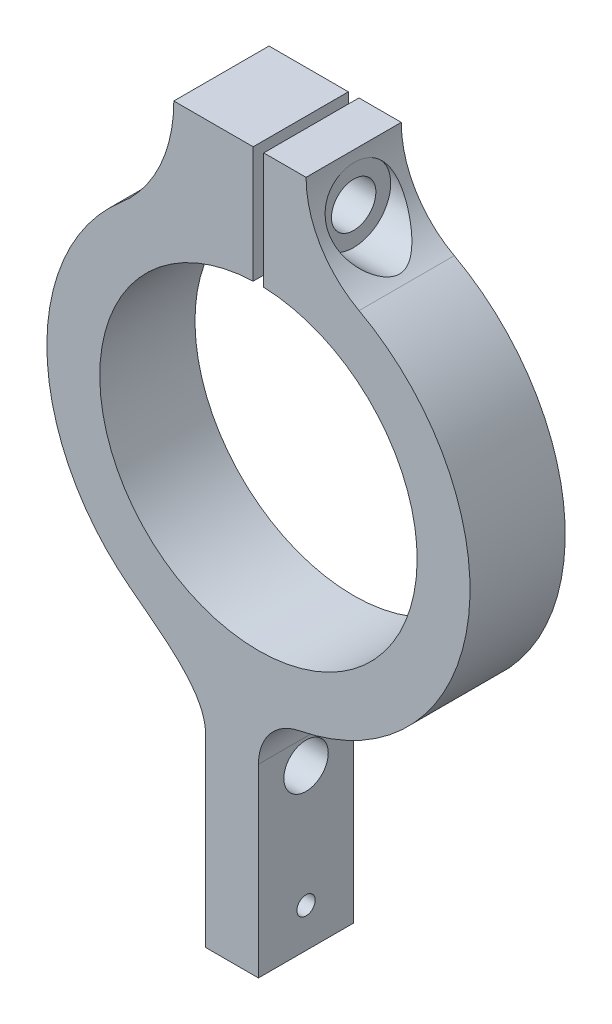
from build123d import *

# Parameters (mm, degrees)
MAIN_BODY_DEPTH       = 18
SKETCH14_W            = 4.2
SKETCH14_H            = 39
M8_CLEARANCE_HOLE2_D  = 8.4
M8_CLEARANCE_HOLE3_D  = 8.4
SKETCH27_R            = 7
CUT_EXTRUDE2_DEPTH    = 99.559772913
F_8_32_TAPPED_HOLE1_D = 3.4544


with BuildPart() as part:
    # Sketch1 → main body (new body)
    with BuildSketch(Plane.XY):
        with BuildLine():
            Line((0, -48.600411521), (0, -83.600411521))
            Line((0, -83.600411521), (-10, -83.600411521))
            Line((-10, -83.600411521), (-10, -48.600411521))
            add(Edge.make_bspline(
                [(-26.535230031, -29.931280748), (-20.948212629, -34.88438627), (-10, -40.904022772), (-10, -48.600411521)],
                knots=[0, 0, 0, 0, 1, 1, 1, 1], degree=3))
            ThreePointArc((-26.535230031, -29.931280748), (-39.998128482, 0.386934068), (-25.951219512, 30.43902439))
            ThreePointArc((-25.951219512, 30.43902439), (-18.607817439, 40.126684972), (-16, 52))
            Line((-16, 52), (-1, 52))
            Line((-1, 52), (-1, 29.983328701))
            ThreePointArc((-1, 29.983328701), (0, -30), (1, 29.983328701))
            Line((1, 29.983328701), (1, 52))
            Line((1, 52), (9, 52))
            ThreePointArc((9, 52), (11.695932832, 42.212959957), (19.02319236, 35.186903138))
            ThreePointArc((19.02319236, 35.186903138), (39.54457484, -6.018853774), (7.693084301, -39.253234949))
            ThreePointArc((7.693084301, -39.253234949), (2.170592409, -42.547452411), (0, -48.600411521))
        make_face()
    extrude(amount=MAIN_BODY_DEPTH)

    # Sketch14 → M8 Clearance Hole1 (revolve, cut)
    with BuildSketch(Plane(origin=(1, 43, 9), x_dir=(0, 0, 1), z_dir=(0, 1, 0))):
        with Locations((2.1, 19.5)):
            Rectangle(SKETCH14_W, SKETCH14_H)
    revolve(axis=Axis((-5.35, 43, 9), (1, 0, 0)), mode=Mode.SUBTRACT)

    # M8 Clearance Hole2 (through all)
    with Locations(Plane(origin=(1, 0, 0), x_dir=(0, 0, 1), z_dir=(1, 0, 0))):
        with Locations((9, -43)):
            Hole(M8_CLEARANCE_HOLE2_D / 2)

    # M8 Clearance Hole3 (through all)
    with Locations(Plane(origin=(0, 0, 0), x_dir=(0, 0, -1), z_dir=(1, 0, 0))):
        with Locations((-9, -53.34)):
            Hole(M8_CLEARANCE_HOLE3_D / 2)

    # Sketch27 → Cut-Extrude2 (cut, through all)
    with BuildSketch(Plane(origin=(9, 0, 0), x_dir=(0, 0, -1), z_dir=(1, 0, 0))):
        with Locations((-9, 43)):
            Circle(SKETCH27_R)
    extrude(amount=CUT_EXTRUDE2_DEPTH, mode=Mode.SUBTRACT)

    # #8-32 Tapped Hole1 (through all)
    with Locations(Plane(origin=(0, 0, 0), x_dir=(0, 0, -1), z_dir=(1, 0, 0))):
        with Locations((-9, -76.2)):
            Hole(F_8_32_TAPPED_HOLE1_D / 2)


solid = part.part
